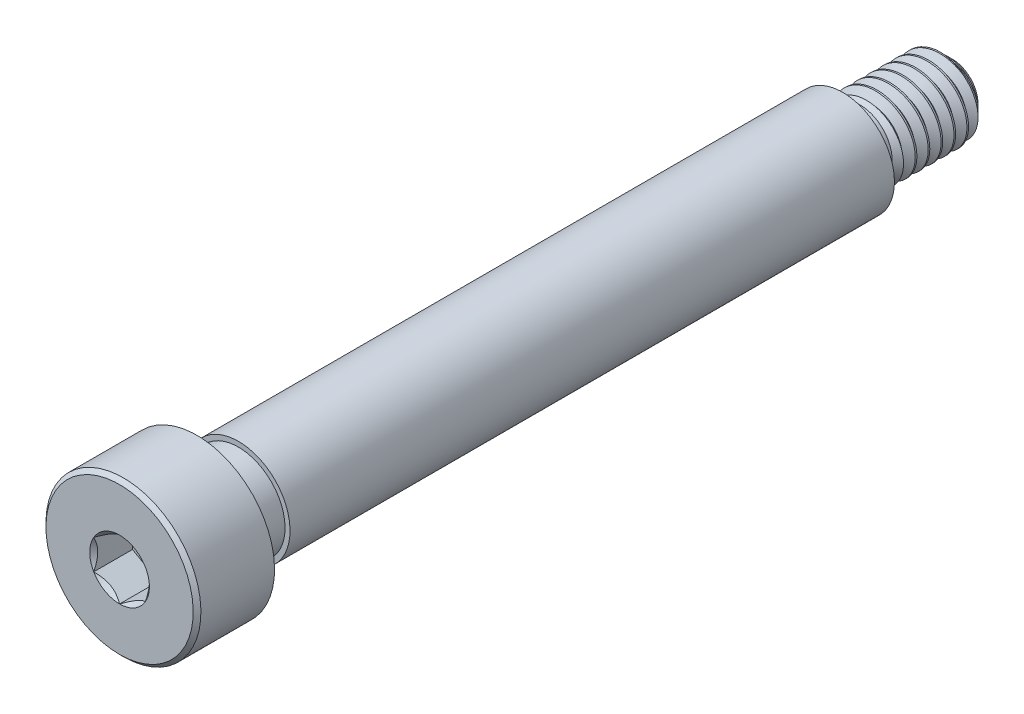
from build123d import *

# Parameters (mm, degrees)
CUT_REVOLVE_THIN1_START         = -11.879
CUT_REVOLVE_THIN1_OUTLINE_R     = 2
CUT_REVOLVE_THIN1_OUTLINE_R_2   = 1.807
CUT_REVOLVE_THIN1_DEPTH         = 23.4
CUT_REVOLVE_THIN1_2_OUTLINE_R   = 2
CUT_REVOLVE_THIN1_2_OUTLINE_R_2 = 1.797
CUT_REVOLVE_THIN1_2_DEPTH       = 23.4
CUT_EXTRUDE1_START              = 16.121
CUT_EXTRUDE1_DEPTH              = 1.5
CHAMFER2_SIZE                   = 0.506148016
CUT_SWEEP1_PITCH                = 0.5
CUT_SWEEP1_TO                   = 3.567136


with BuildPart() as part:
    # Sketch3 → Revolve1 (revolve)
    with BuildSketch(Plane(origin=(0, 0, 0), x_dir=(0, 0, -1), z_dir=(1, 0, 0)), mode=Mode.PRIVATE) as revolve1_sk:
        with BuildLine():
            Line((-16.121, 0), (-16.121, 2.805))
            Line((-16.121, 2.805), (-16.121, 3))
            Line((-16.121, 3), (-13.316, 3))
            Line((-13.316, 3), (-13.121, 3))
            Line((-13.121, 3), (-13.121, 1.797))
            Line((-13.121, 1.797), (-11.521, 1.797))
            Line((-11.521, 1.797), (-11.521, 2))
            Line((-11.521, 2), (11.879, 2))
            Line((11.879, 2), (11.879, 1.36904775))
            ThreePointArc((11.879, 1.36904775), (11.917355026, 1.276450526), (12.00995225, 1.2380955))
            Line((12.00995225, 1.2380955), (12.553864022, 1.2380955))
            Line((12.553864022, 1.2380955), (12.553864022, 1.5))
            Line((12.553864022, 1.5), (15.746, 1.5))
            Line((15.746, 1.5), (16.121, 1.5))
            Line((16.121, 1.5), (16.121, 0))
            Line((16.121, 0), (-16.121, 0))
        make_face()
    revolve(revolve1_sk.sketch.rotate(Axis((0, 0, 16.121), (0, 0, -1)), 180), axis=Axis((0, 0, 16.121), (0, 0, -1)))

    # Cut-Revolve-Thin1 2 outline → Cut-Revolve-Thin1 2 (cut)
    with BuildSketch(Plane.XY.offset(CUT_REVOLVE_THIN1_START)):
        Circle(CUT_REVOLVE_THIN1_2_OUTLINE_R)
        Circle(CUT_REVOLVE_THIN1_2_OUTLINE_R_2, mode=Mode.SUBTRACT)
    extrude(amount=CUT_REVOLVE_THIN1_2_DEPTH, mode=Mode.SUBTRACT)

    # Sketch4 → Cut-Extrude1 (cut)
    with BuildSketch(Plane.XY.offset(CUT_EXTRUDE1_START)):
        Polygon((0, 1.154700538), (-1, 0.577350269), (-1, -0.577350269), (0, -1.154700538), (1, -0.577350269), (1, 0.577350269), align=None)
    extrude(amount=-CUT_EXTRUDE1_DEPTH, mode=Mode.SUBTRACT)

    # Cut-Extrude2 cone 1 section (through the dimple's axis) → Cut-Extrude2 (revolve, cut)
    with BuildSketch(Plane(origin=(0, 0, 16.121), x_dir=(0, -1, 0), z_dir=(1, 0, 0))):
        Polygon((0, 0), (1.154700538, 0), (0, 1.154700538), align=None)
    revolve(axis=Axis((0, 0, 16.121), (0, 0, -1)), mode=Mode.SUBTRACT)

    # Chamfer2
    chamfer2_edges = [part.edges().sort_by_distance(p)[0] for p in [
        (0, 1.5, -16.121),
    ]]
    chamfer(chamfer2_edges, length=CHAMFER2_SIZE)

    # Sketch10 → Cut-Revolve2 (revolve, cut)
    with BuildSketch(Plane(origin=(0, 0, 0), x_dir=(0, 0, -1), z_dir=(1, 0, 0)), mode=Mode.PRIVATE) as cut_revolve2_sk:
        Polygon((-16.121, 2.85), (-15.971, 3), (-16.121, 3), align=None)
    revolve(cut_revolve2_sk.sketch.rotate(Axis((0, 0, 16.121), (0, 0, -1)), 180), axis=Axis((0, 0, 16.121), (0, 0, -1)), mode=Mode.SUBTRACT)


with BuildPart() as body_2:
    # Cut-Revolve-Thin1: read off the stored shape, not the designer's step
    # Cut-Revolve-Thin1 outline → Cut-Revolve-Thin1 (new body)
    with BuildSketch(Plane.XY.offset(CUT_REVOLVE_THIN1_START)):
        Circle(CUT_REVOLVE_THIN1_OUTLINE_R)
        Circle(CUT_REVOLVE_THIN1_OUTLINE_R_2, mode=Mode.SUBTRACT)
    extrude(amount=CUT_REVOLVE_THIN1_DEPTH)


with BuildPart() as body_3:
    # Split1: read off the stored shape, not the designer's step
    # Split1: the piece on the far side of the plane
    add(part.part)
    split(bisect_by=Plane.XY.offset(-12.553864022), keep=Keep.BOTTOM)

    # Cut-Sweep1: arcs per turn and ends read off the stored shape
    # Cut-Sweep1: the profile of Sketch7 screwed along a right-hand helix through 9 turns, 6 arcs to a turn; built about Z, then put on its axis
    cut_sweep1_z = Axis((0, 0, 0), (0, 0, 1))
    cut_sweep1_corners = [(1.527063294, 0, 0.015625), (1.175240474, 0, -0.1875), (1.175240474, 0, -0.25), (1.527063294, 0, -0.453125)]
    with BuildLine(mode=Mode.PRIVATE) as cut_sweep1_profile:
        Line(cut_sweep1_corners[0], cut_sweep1_corners[1])
        Line(cut_sweep1_corners[1], cut_sweep1_corners[2])
        Line(cut_sweep1_corners[2], cut_sweep1_corners[3])
        Line(cut_sweep1_corners[3], cut_sweep1_corners[0])
    cut_sweep1_cap = Face(cut_sweep1_profile.wire())
    cut_sweep1_turn_angles = [0, 30, 60, 90, 120, 150, 180, 210, 240, 270, 300, 330, 360]
    cut_sweep1_turn_weights = [1, 0.8660254037844387, 1, 0.8660254037844387, 1, 0.8660254037844387, 1, 0.8660254037844387, 1, 0.8660254037844387, 1, 0.8660254037844387, 1]
    cut_sweep1_turn_rails = [Edge.make_bspline([Vector(p[0], p[1], 0).rotate(cut_sweep1_z, cut_sweep1_turn_angles[k]) / cut_sweep1_turn_weights[k] + Vector(0, 0, p[2] + CUT_SWEEP1_PITCH * cut_sweep1_turn_angles[k] / 360) for k in range(13)], [0, 0, 0, 1, 1, 2, 2, 3, 3, 4, 4, 5, 5, 6, 6, 6], 2, cut_sweep1_turn_weights) for p in cut_sweep1_corners]
    cut_sweep1_turn_sides = [Face.make_surface_from_curves(cut_sweep1_turn_rails[p[0]], cut_sweep1_turn_rails[p[1]]) for p in [(0, 1), (1, 2), (2, 3), (3, 0)]]
    cut_sweep1 = Plane(origin=(0, 0, -16.121), x_dir=(0, 1, 0), z_dir=(0, 0, 1)) * split(Solid(Shell([*[p.moved(Location((0, 0, CUT_SWEEP1_PITCH * i))) for i in range(9) for p in cut_sweep1_turn_sides], cut_sweep1_cap, cut_sweep1_cap.rotate(cut_sweep1_z, 3240).moved(Location((0, 0, CUT_SWEEP1_PITCH * 3240 / 360)))])), bisect_by=Plane.XY.offset(CUT_SWEEP1_TO), keep=Keep.BOTTOM, mode=Mode.PRIVATE)
    add(cut_sweep1, mode=Mode.SUBTRACT)

    # Sketch11 → Cut-Revolve3 (revolve, cut)
    with BuildSketch(Plane(origin=(0, 0, 0), x_dir=(0, 0, -1), z_dir=(1, 0, 0)), mode=Mode.PRIVATE) as cut_revolve3_sk:
        with BuildLine():
            Line((12.553864022, 1.2380955), (12.00995225, 1.2380955))
            ThreePointArc((12.00995225, 1.2380955), (11.917355026, 1.276450526), (11.879, 1.36904775))
            Line((11.879, 1.36904775), (11.879, 1.5))
            Line((11.879, 1.5), (12.815768522, 1.5))
            Line((12.815768522, 1.5), (12.553864022, 1.2380955))
        make_face()
    revolve(cut_revolve3_sk.sketch.rotate(Axis((0, 0, 16.121), (0, 0, -1)), 180), axis=Axis((0, 0, 16.121), (0, 0, -1)), mode=Mode.SUBTRACT)


with BuildPart() as part_1:
    add(part.part)

    # Split1
    split(bisect_by=Plane.XY.offset(-12.553864022), keep=Keep.TOP)


with BuildPart() as body_3_1:
    add(body_3.part)

    # Combine1: union part
    add(part_1.part)


solid = Compound([body_2.part, body_3_1.part])
